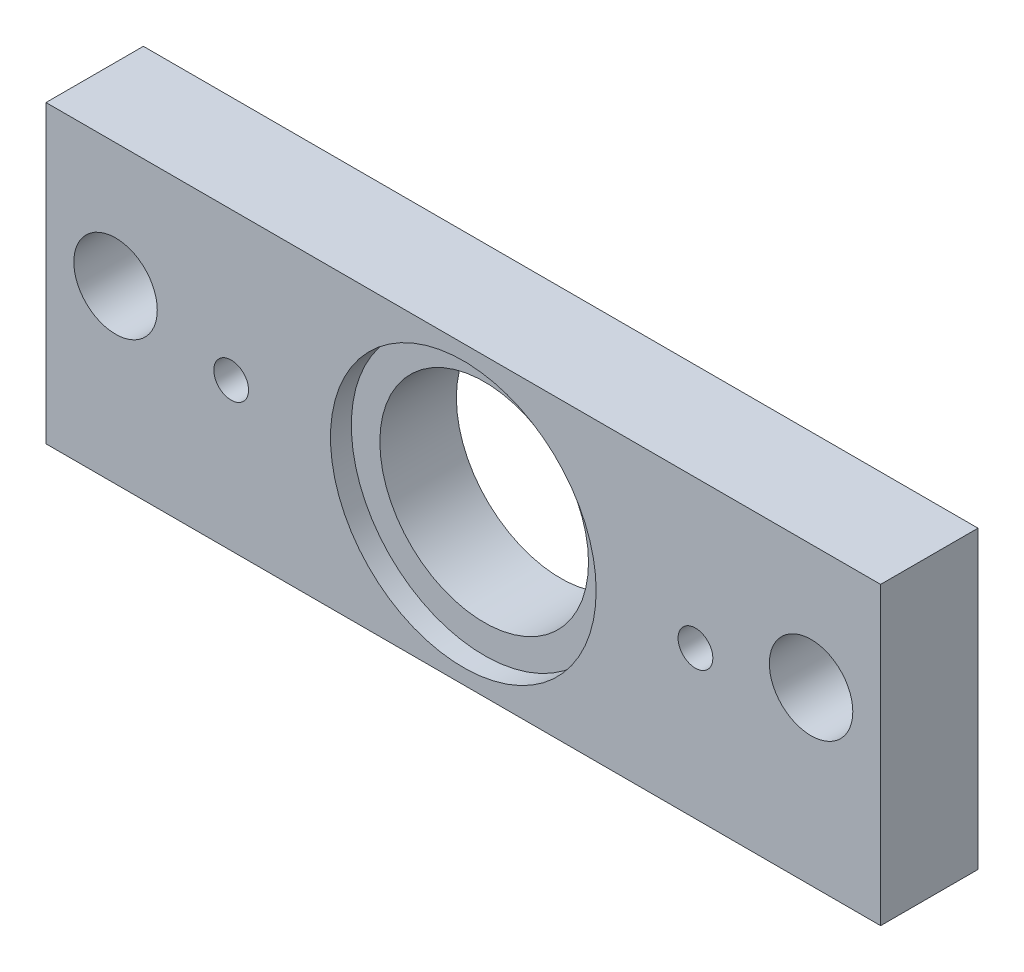
from build123d import *

# Parameters (mm, degrees)
SKETCH1_W           = 120
SKETCH1_H           = 42.5
BOSS_EXTRUDE1_DEPTH = 7
SKETCH2_R           = 19.1
CUT_EXTRUDE1_DEPTH  = 3
SKETCH3_R           = 15
CUT_EXTRUDE2_DEPTH  = 65.595375221
SKETCH4_R           = 2.5
CUT_EXTRUDE3_DEPTH  = 66.173326599
SKETCH5_R           = 6
CUT_EXTRUDE4_DEPTH  = 66.173326599
SKETCH6_R           = 2.5
SKETCH6_R_2         = 1.25
CUT_EXTRUDE5_DEPTH  = 10


with BuildPart() as part:
    # Sketch1 → Boss-Extrude1 (new, symmetric)
    with BuildSketch(Plane.XY):
        Rectangle(SKETCH1_W, SKETCH1_H)
    extrude(amount=BOSS_EXTRUDE1_DEPTH, both=True)

    # Sketch2 → Cut-Extrude1 (cut)
    with BuildSketch(Plane.XY.offset(7)):
        Circle(SKETCH2_R)
    extrude(amount=-CUT_EXTRUDE1_DEPTH, mode=Mode.SUBTRACT)

    # Sketch3 → Cut-Extrude2 (cut, through all)
    with BuildSketch(Plane.XY.offset(4)):
        Circle(SKETCH3_R)
    extrude(amount=-CUT_EXTRUDE2_DEPTH, mode=Mode.SUBTRACT)

    # Sketch4 → Cut-Extrude3 (cut, through all)
    with BuildSketch(Plane.XY.offset(7)):
        with Locations((-33.375, 0)):
            Circle(SKETCH4_R)
        with Locations((33.375, 0)):
            Circle(SKETCH4_R)
    extrude(amount=-CUT_EXTRUDE3_DEPTH, mode=Mode.SUBTRACT)

    # Sketch5 → Cut-Extrude4 (cut, through all)
    with BuildSketch(Plane.XY.offset(7)):
        with Locations((-50, 3.4)):
            Circle(SKETCH5_R)
        with Locations((50, 3.4)):
            Circle(SKETCH5_R)
    extrude(amount=-CUT_EXTRUDE4_DEPTH, mode=Mode.SUBTRACT)

    # Sketch6 → Cut-Extrude5 (cut)
    with BuildSketch(Plane.XZ.offset(21.25)):
        with Locations((-50, 0)):
            Circle(SKETCH6_R)
        with Locations((-25, 0)):
            Circle(SKETCH6_R)
        with Locations((25, 0)):
            Circle(SKETCH6_R)
        with Locations((50, 0)):
            Circle(SKETCH6_R)
        with Locations((-37.5, 0)):
            Circle(SKETCH6_R_2)
        with Locations((37.5, 0)):
            Circle(SKETCH6_R_2)
    extrude(amount=-CUT_EXTRUDE5_DEPTH, mode=Mode.SUBTRACT)


solid = part.part
